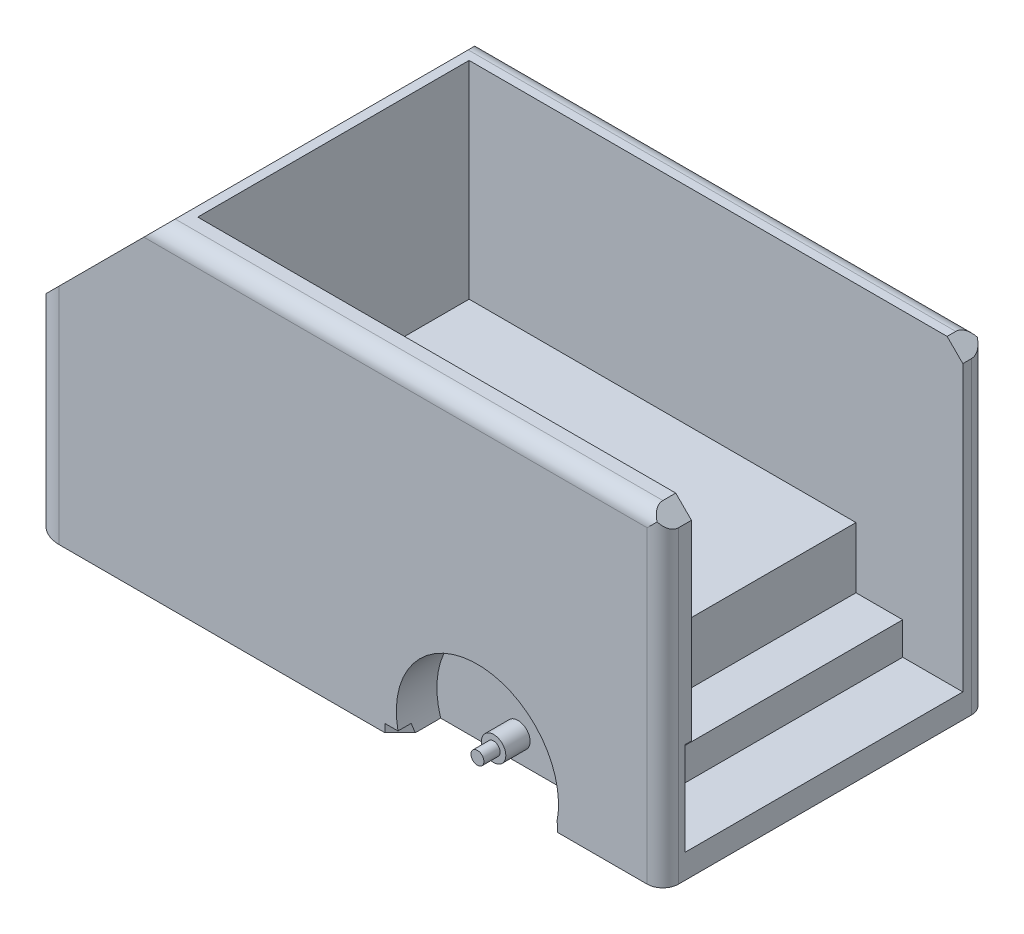
from build123d import *

# Parameters (mm, degrees)
BOSS_EXTRUDE1_DEPTH = 2.54
SKETCH2_W           = 203.2
SKETCH2_H           = 101.6
BOSS_EXTRUDE2_DEPTH = 99.06
CHAMFER2_SIZE       = 45.56
CHAMFER3_SIZE       = 4.92
CHAMFER4_SIZE       = 4.92
FILLET1_R           = 4.92
FILLET3_R           = 4.92
CHAMFER5_SIZE       = 10
FILLET4_R           = 10
SKETCH4_R           = 25.4
CUT_EXTRUDE1_DEPTH  = 12.7
SKETCH5_R           = 3.81
BOSS_EXTRUDE3_DEPTH = 7.62
SKETCH7_R           = 2.032
BOSS_EXTRUDE4_DEPTH = 5.08
SKETCH8_R           = 19.05
CUT_EXTRUDE2_DEPTH  = 3.81
SKETCH9_W           = 185.084164058
SKETCH9_H           = 84.996684453
CUT_EXTRUDE3_DEPTH  = 64.77
SKETCH10_W          = 37.50506442
SKETCH10_H          = 86.993995576
CUT_EXTRUDE4_DEPTH  = 29.21
SKETCH11_W          = 25.743121139
SKETCH11_H          = 84.996684453
CUT_EXTRUDE5_DEPTH  = 19.05


with BuildPart() as part:
    # Sketch1 → Boss-Extrude1 (new body)
    with BuildSketch(Plane(origin=(0, 0, 0), x_dir=(1, 0, 0), z_dir=(0, 1, 0))):
        with BuildLine():
            Line((14.508978226, 50.8), (22.487986765, 42.820991461))
            Line((22.487986765, 42.820991461), (37.396380497, 42.820991461))
            Line((37.396380497, 42.820991461), (37.396380497, 38.724667236))
            Line((37.396380497, 38.724667236), (49.657488857, 38.724667236))
            Line((49.657488857, 38.724667236), (49.657488857, 42.820991461))
            Line((49.657488857, 42.820991461), (57.422857485, 42.820991461))
            add(Edge.make_bspline(
                [(57.422857485, 42.820991461), (65.475972879, 42.629610348), (68.662206814, 50.8)],
                knots=[0, 0, 0, 1, 1, 1], degree=2))
            Line((68.662206814, 50.8), (101.6, 50.8))
            Line((101.6, 50.8), (101.6, -50.8))
            Line((101.6, -50.8), (68.662206814, -50.8))
            add(Edge.make_bspline(
                [(57.422857485, -42.820991461), (65.475972879, -42.629610348), (68.662206814, -50.8)],
                knots=[0, 0, 0, 1, 1, 1], degree=2))
            Line((57.422857485, -42.820991461), (49.657488857, -42.820991461))
            Line((49.657488857, -42.820991461), (49.657488857, -38.724667236))
            Line((49.657488857, -38.724667236), (37.396380497, -38.724667236))
            Line((37.396380497, -38.724667236), (37.396380497, -42.820991461))
            Line((37.396380497, -42.820991461), (22.487986765, -42.820991461))
            Line((22.487986765, -42.820991461), (14.508978226, -50.8))
            Line((14.508978226, -50.8), (-101.6, -50.8))
            Line((-101.6, -50.8), (-101.6, 50.8))
            Line((-101.6, 50.8), (14.508978226, 50.8))
        make_face()
    extrude(amount=BOSS_EXTRUDE1_DEPTH)

    # Sketch2 → Boss-Extrude2 (add)
    with BuildSketch(Plane(origin=(0, 2.54, 0), x_dir=(1, 0, 0), z_dir=(0, 1, 0))):
        Rectangle(SKETCH2_W, SKETCH2_H)
    extrude(amount=BOSS_EXTRUDE2_DEPTH)

    # Chamfer2
    chamfer2_edges = [part.edges().sort_by_distance(p)[0] for p in [
        (-101.6, 101.6, 0),
    ]]
    chamfer(chamfer2_edges, length=CHAMFER2_SIZE)

    # Chamfer3
    chamfer3_edges = [part.edges().sort_by_distance(p)[0] for p in [
        (101.6, 101.6, 0),
    ]]
    chamfer(chamfer3_edges, length=CHAMFER3_SIZE)

    # Chamfer4
    chamfer4_edges = [part.edges().sort_by_distance(p)[0] for p in [
        (-101.6, 0, 0),
    ]]
    chamfer(chamfer4_edges, length=CHAMFER4_SIZE)

    # Fillet1
    fillet1_edges = [part.edges().sort_by_distance(p)[0] for p in [
        (20.32, 101.6, -50.8),
        (20.32, 101.6, 50.8),
    ]]
    fillet(fillet1_edges, radius=FILLET1_R)

    # Fillet3
    fillet3_edges = [part.edges().sort_by_distance(p)[0] for p in [
        (101.6, 48.34, 50.8),
        (101.6, 48.34, -50.8),
    ]]
    fillet(fillet3_edges, radius=FILLET3_R - 0.0001)  # a hair under: the kernel refuses the full size

    # Chamfer5
    chamfer5_edges = [part.edges().sort_by_distance(p)[0] for p in [
        (-101.6, 30.48, -50.8),
        (-101.6, 30.48, 50.8),
    ]]
    chamfer(chamfer5_edges, length=CHAMFER5_SIZE)

    # Fillet4
    fillet4_edges = [part.edges().sort_by_distance(p)[0] for p in [
        (-101.6, 4.92, 0),
        (-101.6, 56.04, 0),
        (-101.6, 30.48, 40.8),
        (-101.6, 30.48, -40.8),
        (-91.6, 33.02, -50.8),
        (-91.6, 33.02, 50.8),
    ]]
    fillet(fillet4_edges, radius=FILLET4_R)

    # Sketch4 → Cut-Extrude1 (cut)
    with BuildSketch(Plane.XY.offset(50.8)):
        with Locations((43.526934677, 7.68715588)):
            Circle(SKETCH4_R)
    cut_extrude1 = extrude(amount=-CUT_EXTRUDE1_DEPTH, mode=Mode.SUBTRACT)

    # Mirror1: Cut-Extrude1 across plane
    add(cut_extrude1.mirror(Plane.XY), mode=Mode.SUBTRACT)

    # Sketch5 → Boss-Extrude3 (add)
    with BuildSketch(Plane.XY.offset(38.1)):
        with Locations((43.526934677, 7.68715588)):
            Circle(SKETCH5_R)
    boss_extrude3 = extrude(amount=BOSS_EXTRUDE3_DEPTH)

    # Mirror2: Boss-Extrude3 across plane
    add(boss_extrude3.mirror(Plane.XY))

    # Sketch7 → Boss-Extrude4 (add)
    with BuildSketch(Plane.XY.offset(45.72)):
        with Locations((43.526934677, 7.68715588)):
            Circle(SKETCH7_R)
    boss_extrude4 = extrude(amount=BOSS_EXTRUDE4_DEPTH)

    # Mirror3: Boss-Extrude4 across plane
    add(boss_extrude4.mirror(Plane.XY))

    # Sketch8 → Cut-Extrude2 (cut)
    with BuildSketch(Plane.XZ):
        with Locations(Location((-57.478175649, 0, 0), (0, 0, 270))):
            Circle(SKETCH8_R)
    extrude(amount=-CUT_EXTRUDE2_DEPTH, mode=Mode.SUBTRACT)

    # Sketch9 → Cut-Extrude3 (cut)
    with BuildSketch(Plane(origin=(0, 101.6, 0), x_dir=(1, 0, 0), z_dir=(0, 1, 0))):
        with Locations((39.502375542, 0.665770374)):
            Rectangle(SKETCH9_W, SKETCH9_H)
    extrude(amount=-CUT_EXTRUDE3_DEPTH, mode=Mode.SUBTRACT)

    # Sketch10 → Cut-Extrude4 (cut)
    with BuildSketch(Plane(origin=(0, 36.83, 0), x_dir=(1, 0, 0), z_dir=(0, 1, 0))):
        with Locations((101.529982082, -0.332885187)):
            Rectangle(SKETCH10_W, SKETCH10_H)
    extrude(amount=-CUT_EXTRUDE4_DEPTH, mode=Mode.SUBTRACT)

    # Sketch11 → Cut-Extrude5 (cut)
    with BuildSketch(Plane(origin=(0, 36.83, 0), x_dir=(1, 0, 0), z_dir=(0, 1, 0))):
        with Locations((81.002062208, 0.665770374)):
            Rectangle(SKETCH11_W, SKETCH11_H)
    extrude(amount=-CUT_EXTRUDE5_DEPTH, mode=Mode.SUBTRACT)


solid = part.part
